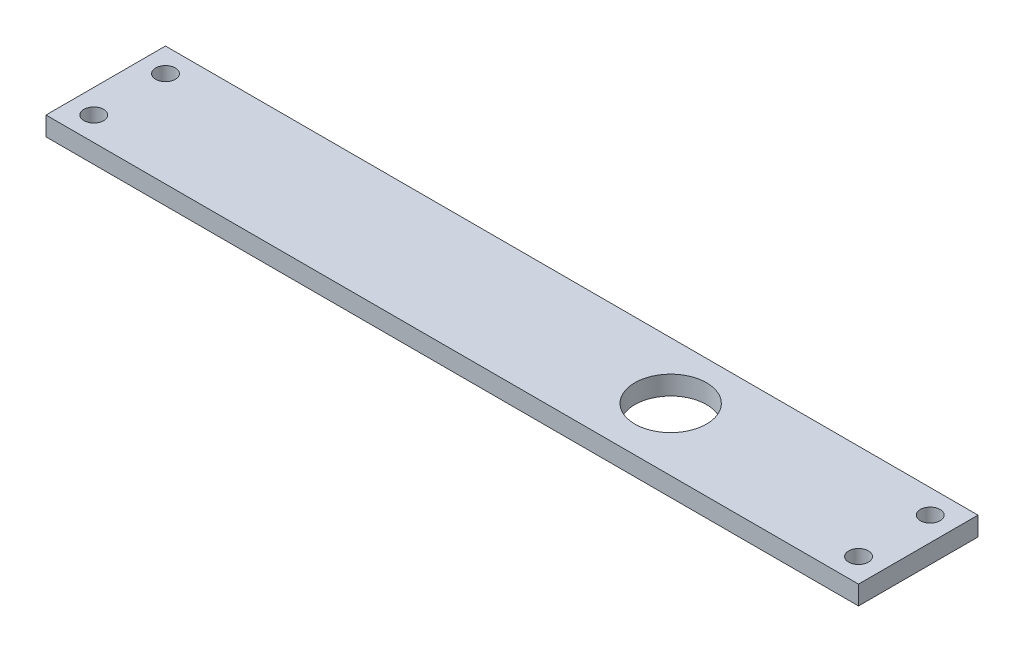
from build123d import *

# Parameters (mm, degrees)
SKETCH1_W           = 136
SKETCH1_H           = 20
SKETCH1_R           = 1.65
SKETCH1_R_2         = 6
BOSS_EXTRUDE1_DEPTH = 3.175


with BuildPart() as part:
    # Sketch1 → Boss-Extrude1 (new body)
    with BuildSketch(Plane(origin=(0, 0, 0), x_dir=(1, 0, 0), z_dir=(0, 1, 0))):
        with Locations((68, -10)):
            Rectangle(SKETCH1_W, SKETCH1_H)
        with Locations((4, -4)):
            Circle(SKETCH1_R, mode=Mode.SUBTRACT)
        with Locations((132, -4)):
            Circle(SKETCH1_R, mode=Mode.SUBTRACT)
        with Locations((94.08554011, -9.52416591)):
            Circle(SKETCH1_R_2, mode=Mode.SUBTRACT)
        with Locations((4, -16)):
            Circle(SKETCH1_R, mode=Mode.SUBTRACT)
        with Locations((132, -16)):
            Circle(SKETCH1_R, mode=Mode.SUBTRACT)
    extrude(amount=BOSS_EXTRUDE1_DEPTH)


solid = part.part
